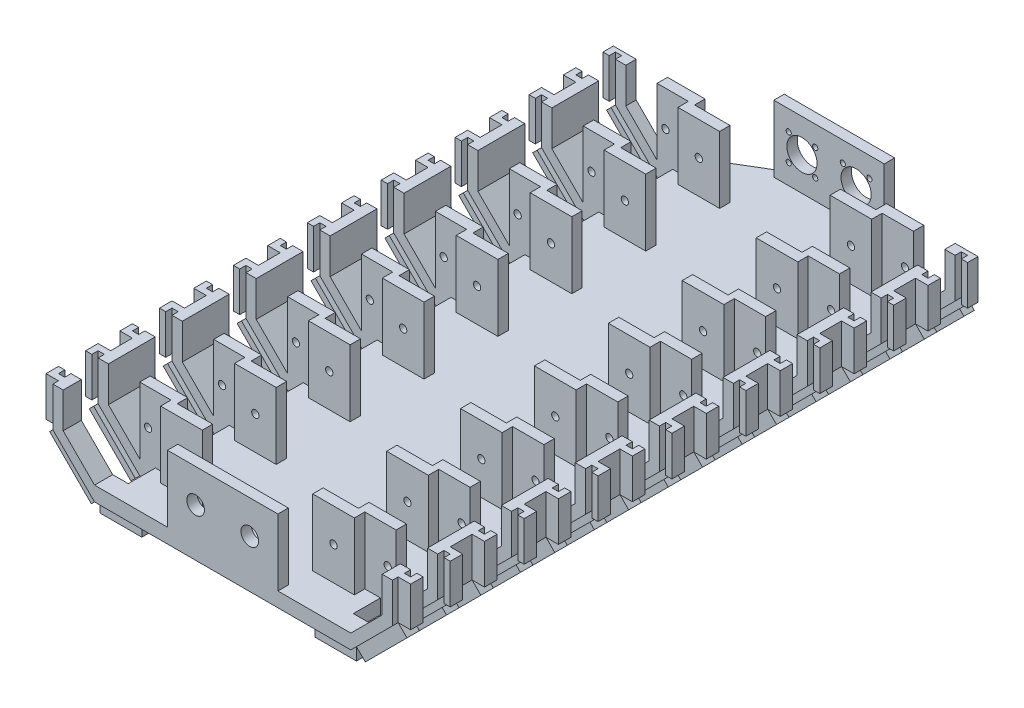
from build123d import *

# Parameters (mm, degrees)
BOSS_EXTRUDE1_DEPTH     = 7
SKETCH2_W               = 123
SKETCH2_H               = 5
BOSS_EXTRUDE2_DEPTH     = 32
SKETCH9_W               = 123
SKETCH9_H               = 7
BOSS_EXTRUDE4_DEPTH     = 5
SKETCH10_W              = 18
SKETCH10_H              = 5
BOSS_EXTRUDE8_DEPTH     = 32
BOSS_EXTRUDE9_DEPTH     = 32
CUT_EXTRUDE4_DEPTH      = 250
CUT_EXTRUDE4_DEPTH_BACK = 32
SKETCH8_R               = 1.75
SKETCH13_W              = 35
SKETCH13_H              = 32
CUT_EXTRUDE5_DEPTH      = 11
BOSS_EXTRUDE10_DEPTH    = 275
CUT_EXTRUDE6_DEPTH      = 166.124952687
CUT_EXTRUDE6_DEPTH_BACK = 166.124952687
SKETCH15_W              = 27.5
SKETCH15_H              = 13
CUT_EXTRUDE7_DEPTH      = 269.925937824
CUT_EXTRUDE7_DEPTH_BACK = 269.925937824
SKETCH16_R              = 1.75
BOSS_EXTRUDE13_DEPTH    = 7
SKETCH18_W              = 53
SKETCH18_H              = 5
BOSS_EXTRUDE14_DEPTH    = 32
SKETCH3_R               = 4.25
CUT_EXTRUDE8_DEPTH      = 334
SKETCH19_R              = 7.25
SKETCH19_R_2            = 1.25
CUT_EXTRUDE9_DEPTH      = 334
SKETCH22_W              = 2
SKETCH22_H              = 28.284271247
SKETCH22_W_2            = 3
BOSS_EXTRUDE15_DEPTH    = 3
SKETCH23_W              = 5
SKETCH23_H              = 28.284271247
SKETCH23_W_2            = 6
BOSS_EXTRUDE16_DEPTH    = 3
SKETCH24_W              = 2
SKETCH24_H              = 19
SKETCH24_W_2            = 3
BOSS_EXTRUDE18_DEPTH    = 3
SKETCH25_W              = 6
SKETCH25_H              = 19
SKETCH25_W_2            = 5
BOSS_EXTRUDE19_DEPTH    = 3
SKETCH27_W              = 20
SKETCH27_H              = 3
SKETCH27_H_2            = 2
BOSS_EXTRUDE25_DEPTH    = 3
SKETCH28_W              = 20
SKETCH28_H              = 6
SKETCH28_H_2            = 5
BOSS_EXTRUDE26_DEPTH    = 3
CUT_EXTRUDE13_DEPTH     = 19


with BuildPart() as part:
    # Sketch1 → Boss-Extrude1 (new body)
    with BuildSketch(Plane(origin=(0, 0, 0), x_dir=(1, 0, 0), z_dir=(0, 1, 0))):
        Polygon((-13, 135), (-36, 135), (-61.5, 135), (-61.5, -135), (-36, -135), (-13, -135), (13, -135), (36, -135), (61.5, -135), (61.5, 135), (36, 135), (13, 135), align=None)
    extrude(amount=BOSS_EXTRUDE1_DEPTH)

    # Sketch2 → Boss-Extrude2 (add)
    with BuildSketch(Plane(origin=(0, 7, 0), x_dir=(1, 0, 0), z_dir=(0, 1, 0))):
        with Locations((0, -132.5)):
            Rectangle(SKETCH2_W, SKETCH2_H)
        Polygon((-36.5, 135), (-26.5, 135), (-26.5, 130), (-46.5, 130), (-46.5, 135), align=None)
        Polygon((46.5, 130), (26.5, 130), (26.5, 135), (36.5, 135), (46.5, 135), align=None)
    extrude(amount=BOSS_EXTRUDE2_DEPTH)

    # Sketch9 → Boss-Extrude4 (add)
    with BuildSketch(Plane(origin=(0, 0, -135), x_dir=(-1, 0, 0), z_dir=(0, 0, -1))):
        with Locations((0, 3.5)):
            Rectangle(SKETCH9_W, SKETCH9_H)
    extrude(amount=BOSS_EXTRUDE4_DEPTH)

    # Sketch10 → Boss-Extrude8 (add)
    with BuildSketch(Plane(origin=(0, 7, 0), x_dir=(1, 0, 0), z_dir=(0, 1, 0))):
        with Locations((-52.5, 137.5)):
            Rectangle(SKETCH10_W, SKETCH10_H)
        with Locations((52.5, 137.5)):
            Rectangle(SKETCH10_W, SKETCH10_H)
    extrude(amount=BOSS_EXTRUDE8_DEPTH)

    # Sketch11 → Boss-Extrude9 (add)
    with BuildSketch(Plane(origin=(0, 7, 0), x_dir=(1, 0, 0), z_dir=(0, 1, 0))):
        Polygon((-46.5, -118.294117647), (-26.5, -118.294117647), (-26.5, -113.294117647), (-43.5, -113.294117647), (-43.5, -108.294117647), (-61.5, -108.294117647), (-61.5, -113.294117647), (-46.5, -113.294117647), align=None)
        Polygon((-61.5, 104.529411765), (-61.5, 99.529411765), (-46.5, 99.529411765), (-46.5, 94.529411765), (-26.5, 94.529411765), (-26.5, 99.529411765), (-43.5, 99.529411765), (-43.5, 104.529411765), align=None)
        Polygon((-61.5, 69.058823529), (-61.5, 64.058823529), (-46.5, 64.058823529), (-46.5, 59.058823529), (-26.5, 59.058823529), (-26.5, 64.058823529), (-43.5, 64.058823529), (-43.5, 69.058823529), align=None)
        Polygon((-61.5, 33.588235294), (-61.5, 28.588235294), (-46.5, 28.588235294), (-46.5, 23.588235294), (-26.5, 23.588235294), (-26.5, 28.588235294), (-43.5, 28.588235294), (-43.5, 33.588235294), align=None)
        Polygon((-61.5, -1.882352941), (-61.5, -6.882352941), (-46.5, -6.882352941), (-46.5, -11.882352941), (-26.5, -11.882352941), (-26.5, -6.882352941), (-43.5, -6.882352941), (-43.5, -1.882352941), align=None)
        Polygon((-61.5, -37.352941176), (-61.5, -42.352941176), (-46.5, -42.352941176), (-46.5, -47.352941176), (-26.5, -47.352941176), (-26.5, -42.352941176), (-43.5, -42.352941176), (-43.5, -37.352941176), align=None)
        Polygon((-61.5, -72.823529412), (-61.5, -77.823529412), (-46.5, -77.823529412), (-46.5, -82.823529412), (-26.5, -82.823529412), (-26.5, -77.823529412), (-43.5, -77.823529412), (-43.5, -72.823529412), align=None)
        Polygon((46.5, 99.529411765), (61.5, 99.529411765), (61.5, 104.529411765), (43.5, 104.529411765), (43.5, 99.529411765), (26.5, 99.529411765), (26.5, 94.529411765), (46.5, 94.529411765), align=None)
        Polygon((46.5, 64.058823529), (61.5, 64.058823529), (61.5, 69.058823529), (43.5, 69.058823529), (43.5, 64.058823529), (26.5, 64.058823529), (26.5, 59.058823529), (46.5, 59.058823529), align=None)
        Polygon((46.5, 28.588235294), (61.5, 28.588235294), (61.5, 33.588235294), (43.5, 33.588235294), (43.5, 28.588235294), (26.5, 28.588235294), (26.5, 23.588235294), (46.5, 23.588235294), align=None)
        Polygon((46.5, -6.882352941), (61.5, -6.882352941), (61.5, -1.882352941), (43.5, -1.882352941), (43.5, -6.882352941), (26.5, -6.882352941), (26.5, -11.882352941), (46.5, -11.882352941), align=None)
        Polygon((46.5, -42.352941176), (61.5, -42.352941176), (61.5, -37.352941176), (43.5, -37.352941176), (43.5, -42.352941176), (26.5, -42.352941176), (26.5, -47.352941176), (46.5, -47.352941176), align=None)
        Polygon((46.5, -77.823529412), (61.5, -77.823529412), (61.5, -72.823529412), (43.5, -72.823529412), (43.5, -77.823529412), (26.5, -77.823529412), (26.5, -82.823529412), (46.5, -82.823529412), align=None)
        Polygon((43.5, -108.294117647), (43.5, -113.294117647), (26.5, -113.294117647), (26.5, -118.294117647), (46.5, -118.294117647), (46.5, -113.294117647), (61.5, -113.294117647), (61.5, -108.294117647), align=None)
    extrude(amount=BOSS_EXTRUDE9_DEPTH)

    # Sketch8 → Cut-Extrude4 (cut, two sides: drawn at the far end of the back side and taken through both)
    with BuildSketch(Plane.XY.offset(-130).offset(-CUT_EXTRUDE4_DEPTH_BACK)):
        with Locations((-36.5, 23)):
            Circle(SKETCH8_R)
        with Locations((36.5, 23)):
            Circle(SKETCH8_R)
    extrude(amount=CUT_EXTRUDE4_DEPTH + CUT_EXTRUDE4_DEPTH_BACK, mode=Mode.SUBTRACT)

    # Sketch13 → Cut-Extrude5 (cut)
    with BuildSketch(Plane.XY.offset(135)):
        with Locations((-44, 23)):
            Rectangle(SKETCH13_W, SKETCH13_H)
        with Locations((44, 23)):
            Rectangle(SKETCH13_W, SKETCH13_H)
    extrude(amount=-CUT_EXTRUDE5_DEPTH, mode=Mode.SUBTRACT)

    # Sketch14 → Boss-Extrude10 (add)
    with BuildSketch(Plane.XY.offset(135)):
        Polygon((-61.5, 0), (-81.5, 20), (-81.5, 39), (-76.55, 39), (-76.55, 22.05), (-61.5, 7), align=None)
        Polygon((76.55, 39), (76.55, 22.05), (61.5, 7), (61.5, 0), (81.5, 20), (81.5, 39), align=None)
    extrude(amount=-BOSS_EXTRUDE10_DEPTH)

    # Sketch15 → Cut-Extrude6 (cut, two sides: drawn at the far end of the back side and taken through both)
    with BuildSketch(Plane(origin=(0, 7, 0), x_dir=(1, 0, 0), z_dir=(0, 1, 0)).offset(-CUT_EXTRUDE6_DEPTH_BACK)):
        with Locations((-67.75, 128.5)):
            Rectangle(SKETCH15_W, SKETCH15_H)
        with Locations((-67.75, 93.029411765)):
            Rectangle(SKETCH15_W, SKETCH15_H)
        with Locations((-67.75, 57.558823529)):
            Rectangle(SKETCH15_W, SKETCH15_H)
        with Locations((-67.75, 22.088235294)):
            Rectangle(SKETCH15_W, SKETCH15_H)
        with Locations((-67.75, -13.382352941)):
            Rectangle(SKETCH15_W, SKETCH15_H)
        with Locations((-67.75, -48.852941176)):
            Rectangle(SKETCH15_W, SKETCH15_H)
        with Locations((-67.75, -84.323529412)):
            Rectangle(SKETCH15_W, SKETCH15_H)
        with Locations((-67.75, -119.794117647)):
            Rectangle(SKETCH15_W, SKETCH15_H)
        with Locations((67.75, -119.794117647)):
            Rectangle(SKETCH15_W, SKETCH15_H)
        with Locations((67.75, -84.323529412)):
            Rectangle(SKETCH15_W, SKETCH15_H)
        with Locations((67.75, -48.852941176)):
            Rectangle(SKETCH15_W, SKETCH15_H)
        with Locations((67.75, -13.382352941)):
            Rectangle(SKETCH15_W, SKETCH15_H)
        with Locations((67.75, 22.088235294)):
            Rectangle(SKETCH15_W, SKETCH15_H)
        with Locations((67.75, 57.558823529)):
            Rectangle(SKETCH15_W, SKETCH15_H)
        with Locations((67.75, 93.029411765)):
            Rectangle(SKETCH15_W, SKETCH15_H)
        with Locations((67.75, 128.5)):
            Rectangle(SKETCH15_W, SKETCH15_H)
    extrude(amount=CUT_EXTRUDE6_DEPTH + CUT_EXTRUDE6_DEPTH_BACK, mode=Mode.SUBTRACT)

    # Sketch16 → Cut-Extrude7 (cut, two sides: drawn at the far end of the back side and taken through both)
    with BuildSketch(Plane.XY.offset(113.294117647).offset(-CUT_EXTRUDE7_DEPTH_BACK)):
        with Locations((-57.5, 22)):
            Circle(SKETCH16_R)
        with Locations((57.5, 22)):
            Circle(SKETCH16_R)
    extrude(amount=CUT_EXTRUDE7_DEPTH + CUT_EXTRUDE7_DEPTH_BACK, mode=Mode.SUBTRACT)

    # Sketch17 → Boss-Extrude13 (add)
    with BuildSketch(Plane(origin=(0, 7, 0), x_dir=(1, 0, 0), z_dir=(0, 1, 0))):
        Polygon((-61.5, 140), (-26.5, 226), (0, 226), (26.5, 226), (61.5, 140), align=None)
    extrude(amount=-BOSS_EXTRUDE13_DEPTH)

    # Sketch18 → Boss-Extrude14 (add)
    with BuildSketch(Plane(origin=(0, 7, 0), x_dir=(1, 0, 0), z_dir=(0, 1, 0))):
        with Locations((0, 158.5)):
            Rectangle(SKETCH18_W, SKETCH18_H)
    extrude(amount=BOSS_EXTRUDE14_DEPTH)

    # Sketch3 → Cut-Extrude8 (cut)
    with BuildSketch(Plane.XY.offset(135)):
        with Locations((-13, 23)):
            Circle(SKETCH3_R)
        with Locations((13, 23)):
            Circle(SKETCH3_R)
    extrude(amount=-CUT_EXTRUDE8_DEPTH, mode=Mode.SUBTRACT)

    # Sketch19 → Cut-Extrude9 (cut)
    with BuildSketch(Plane.XY.offset(-156)):
        with Locations((-13, 23)):
            Circle(SKETCH19_R)
        with Locations((-6.636038969, 16.636038969)):
            Circle(SKETCH19_R_2)
        with Locations((-6.636038969, 29.363961031)):
            Circle(SKETCH19_R_2)
        with Locations((-19.363961031, 29.363961031)):
            Circle(SKETCH19_R_2)
        with Locations((-19.363961031, 16.636038969)):
            Circle(SKETCH19_R_2)
        with Locations((13, 23)):
            Circle(SKETCH19_R)
        with Locations((19.363961031, 16.636038969)):
            Circle(SKETCH19_R_2)
        with Locations((6.636038969, 16.636038969)):
            Circle(SKETCH19_R_2)
        with Locations((6.636038969, 29.363961031)):
            Circle(SKETCH19_R_2)
        with Locations((19.363961031, 29.363961031)):
            Circle(SKETCH19_R_2)
    extrude(amount=-CUT_EXTRUDE9_DEPTH, mode=Mode.SUBTRACT)

    # Sketch22 → Boss-Extrude15 (add)
    with BuildSketch(Plane(origin=(-30.75, -30.75, 0), x_dir=(0, 0, 1), z_dir=(-0.7071067811865465, -0.7071067811865486, 0))):
        with Locations((-139, 57.629202667)):
            Rectangle(SKETCH22_W, SKETCH22_H)
        with Locations((-117.5, 57.629202667)):
            Rectangle(SKETCH22_W_2, SKETCH22_H)
        with Locations((-104.029411765, 57.629202667)):
            Rectangle(SKETCH22_W_2, SKETCH22_H)
        with Locations((-82.029411765, 57.629202667)):
            Rectangle(SKETCH22_W_2, SKETCH22_H)
        with Locations((-68.558823529, 57.629202667)):
            Rectangle(SKETCH22_W_2, SKETCH22_H)
        with Locations((-46.558823529, 57.629202667)):
            Rectangle(SKETCH22_W_2, SKETCH22_H)
        with Locations((-33.088235294, 57.629202667)):
            Rectangle(SKETCH22_W_2, SKETCH22_H)
        with Locations((-11.088235294, 57.629202667)):
            Rectangle(SKETCH22_W_2, SKETCH22_H)
        with Locations((2.382352941, 57.629202667)):
            Rectangle(SKETCH22_W_2, SKETCH22_H)
        with Locations((24.382352941, 57.629202667)):
            Rectangle(SKETCH22_W_2, SKETCH22_H)
        with Locations((37.852941176, 57.629202667)):
            Rectangle(SKETCH22_W_2, SKETCH22_H)
        with Locations((59.852941176, 57.629202667)):
            Rectangle(SKETCH22_W_2, SKETCH22_H)
        with Locations((73.323529412, 57.629202667)):
            Rectangle(SKETCH22_W_2, SKETCH22_H)
        with Locations((95.323529412, 57.629202667)):
            Rectangle(SKETCH22_W_2, SKETCH22_H)
        with Locations((108.794117647, 57.629202667)):
            Rectangle(SKETCH22_W_2, SKETCH22_H)
        with Locations((130.794117647, 57.629202667)):
            Rectangle(SKETCH22_W_2, SKETCH22_H)
    boss_extrude15 = extrude(amount=BOSS_EXTRUDE15_DEPTH)

    # Sketch23 → Boss-Extrude16 (add)
    with BuildSketch(Plane(origin=(-32.871320344, -32.871320344, 0), x_dir=(0, 0, 1), z_dir=(-0.7071067811865465, -0.7071067811865487, 0))):
        with Locations((-137.5, 57.629202667)):
            Rectangle(SKETCH23_W, SKETCH23_H)
        with Locations((-119, 57.629202667)):
            Rectangle(SKETCH23_W_2, SKETCH23_H)
        with Locations((-102.529411765, 57.629202667)):
            Rectangle(SKETCH23_W_2, SKETCH23_H)
        with Locations((-83.529411765, 57.629202667)):
            Rectangle(SKETCH23_W_2, SKETCH23_H)
        with Locations((-67.058823529, 57.629202667)):
            Rectangle(SKETCH23_W_2, SKETCH23_H)
        with Locations((-48.058823529, 57.629202667)):
            Rectangle(SKETCH23_W_2, SKETCH23_H)
        with Locations((-31.588235294, 57.629202667)):
            Rectangle(SKETCH23_W_2, SKETCH23_H)
        with Locations((-12.588235294, 57.629202667)):
            Rectangle(SKETCH23_W_2, SKETCH23_H)
        with Locations((3.882352941, 57.629202667)):
            Rectangle(SKETCH23_W_2, SKETCH23_H)
        with Locations((22.882352941, 57.629202667)):
            Rectangle(SKETCH23_W_2, SKETCH23_H)
        with Locations((39.352941176, 57.629202667)):
            Rectangle(SKETCH23_W_2, SKETCH23_H)
        with Locations((58.352941176, 57.629202667)):
            Rectangle(SKETCH23_W_2, SKETCH23_H)
        with Locations((74.823529412, 57.629202667)):
            Rectangle(SKETCH23_W_2, SKETCH23_H)
        with Locations((93.823529412, 57.629202667)):
            Rectangle(SKETCH23_W_2, SKETCH23_H)
        with Locations((110.294117647, 57.629202667)):
            Rectangle(SKETCH23_W_2, SKETCH23_H)
        with Locations((129.294117647, 57.629202667)):
            Rectangle(SKETCH23_W_2, SKETCH23_H)
    boss_extrude16 = extrude(amount=BOSS_EXTRUDE16_DEPTH)

    # Sketch24 → Boss-Extrude18 (add)
    with BuildSketch(Plane.ZY.offset(81.5)):
        with Locations((-139, 29.5)):
            Rectangle(SKETCH24_W, SKETCH24_H)
        with Locations((-117.5, 29.5)):
            Rectangle(SKETCH24_W_2, SKETCH24_H)
        with Locations((-104.029411765, 29.5)):
            Rectangle(SKETCH24_W_2, SKETCH24_H)
        with Locations((-82.029411765, 29.5)):
            Rectangle(SKETCH24_W_2, SKETCH24_H)
        with Locations((-68.558823529, 29.5)):
            Rectangle(SKETCH24_W_2, SKETCH24_H)
        with Locations((-46.558823529, 29.5)):
            Rectangle(SKETCH24_W_2, SKETCH24_H)
        with Locations((-33.088235294, 29.5)):
            Rectangle(SKETCH24_W_2, SKETCH24_H)
        with Locations((-11.088235294, 29.5)):
            Rectangle(SKETCH24_W_2, SKETCH24_H)
        with Locations((2.382352941, 29.5)):
            Rectangle(SKETCH24_W_2, SKETCH24_H)
        with Locations((24.382352941, 29.5)):
            Rectangle(SKETCH24_W_2, SKETCH24_H)
        with Locations((37.852941176, 29.5)):
            Rectangle(SKETCH24_W_2, SKETCH24_H)
        with Locations((59.852941176, 29.5)):
            Rectangle(SKETCH24_W_2, SKETCH24_H)
        with Locations((73.323529412, 29.5)):
            Rectangle(SKETCH24_W_2, SKETCH24_H)
        with Locations((95.323529412, 29.5)):
            Rectangle(SKETCH24_W_2, SKETCH24_H)
        with Locations((108.794117647, 29.5)):
            Rectangle(SKETCH24_W_2, SKETCH24_H)
        with Locations((130.794117647, 29.5)):
            Rectangle(SKETCH24_W_2, SKETCH24_H)
    boss_extrude18 = extrude(amount=BOSS_EXTRUDE18_DEPTH)

    # Sketch25 → Boss-Extrude19 (add)
    with BuildSketch(Plane.ZY.offset(84.5)):
        with Locations((-67.058823529, 29.5)):
            Rectangle(SKETCH25_W, SKETCH25_H)
        with Locations((-137.5, 29.5)):
            Rectangle(SKETCH25_W_2, SKETCH25_H)
        with Locations((-119, 29.5)):
            Rectangle(SKETCH25_W, SKETCH25_H)
        with Locations((-102.529411765, 29.5)):
            Rectangle(SKETCH25_W, SKETCH25_H)
        with Locations((-83.529411765, 29.5)):
            Rectangle(SKETCH25_W, SKETCH25_H)
        with Locations((-48.058823529, 29.5)):
            Rectangle(SKETCH25_W, SKETCH25_H)
        with Locations((-31.588235294, 29.5)):
            Rectangle(SKETCH25_W, SKETCH25_H)
        with Locations((-12.588235294, 29.5)):
            Rectangle(SKETCH25_W, SKETCH25_H)
        with Locations((3.882352941, 29.5)):
            Rectangle(SKETCH25_W, SKETCH25_H)
        with Locations((22.882352941, 29.5)):
            Rectangle(SKETCH25_W, SKETCH25_H)
        with Locations((39.352941176, 29.5)):
            Rectangle(SKETCH25_W, SKETCH25_H)
        with Locations((58.352941176, 29.5)):
            Rectangle(SKETCH25_W, SKETCH25_H)
        with Locations((74.823529412, 29.5)):
            Rectangle(SKETCH25_W, SKETCH25_H)
        with Locations((93.823529412, 29.5)):
            Rectangle(SKETCH25_W, SKETCH25_H)
        with Locations((110.294117647, 29.5)):
            Rectangle(SKETCH25_W, SKETCH25_H)
        with Locations((129.294117647, 29.5)):
            Rectangle(SKETCH25_W, SKETCH25_H)
    boss_extrude19 = extrude(amount=BOSS_EXTRUDE19_DEPTH)

    # Mirror1: Boss-Extrude18 across plane
    add(boss_extrude18.mirror(Plane(origin=(0, 0, 0), x_dir=(0, 0, 1), z_dir=(1, 0, 0))))

    # Mirror2: Boss-Extrude19 across plane
    add(boss_extrude19.mirror(Plane(origin=(0, 0, 0), x_dir=(0, 0, 1), z_dir=(1, 0, 0))))

    # Mirror3: Boss-Extrude15 across plane
    add(boss_extrude15.mirror(Plane(origin=(0, 0, 0), x_dir=(0, 0, 1), z_dir=(1, 0, 0))))

    # Mirror4: Boss-Extrude16 across plane
    add(boss_extrude16.mirror(Plane(origin=(0, 0, 0), x_dir=(0, 0, 1), z_dir=(1, 0, 0))))

    # Sketch27 → Boss-Extrude25 (add)
    with BuildSketch(Plane.XZ):
        with Locations((-51.5, 130.794117647)):
            Rectangle(SKETCH27_W, SKETCH27_H)
        with Locations((-51.5, 108.794117647)):
            Rectangle(SKETCH27_W, SKETCH27_H)
        with Locations((-51.5, 95.323529412)):
            Rectangle(SKETCH27_W, SKETCH27_H)
        with Locations((-51.5, 73.323529412)):
            Rectangle(SKETCH27_W, SKETCH27_H)
        with Locations((-51.5, 59.852941176)):
            Rectangle(SKETCH27_W, SKETCH27_H)
        with Locations((-51.5, 37.852941176)):
            Rectangle(SKETCH27_W, SKETCH27_H)
        with Locations((-51.5, 24.382352941)):
            Rectangle(SKETCH27_W, SKETCH27_H)
        with Locations((-51.5, 2.382352941)):
            Rectangle(SKETCH27_W, SKETCH27_H)
        with Locations((-51.5, -11.088235294)):
            Rectangle(SKETCH27_W, SKETCH27_H)
        with Locations((-51.5, -33.088235294)):
            Rectangle(SKETCH27_W, SKETCH27_H)
        with Locations((-51.5, -46.558823529)):
            Rectangle(SKETCH27_W, SKETCH27_H)
        with Locations((-51.5, -68.558823529)):
            Rectangle(SKETCH27_W, SKETCH27_H)
        with Locations((-51.5, -82.029411765)):
            Rectangle(SKETCH27_W, SKETCH27_H)
        with Locations((-51.5, -104.029411765)):
            Rectangle(SKETCH27_W, SKETCH27_H)
        with Locations((-51.5, -117.5)):
            Rectangle(SKETCH27_W, SKETCH27_H)
        with Locations((-51.5, -139)):
            Rectangle(SKETCH27_W, SKETCH27_H_2)
        with Locations((51.5, -139)):
            Rectangle(SKETCH27_W, SKETCH27_H_2)
        with Locations((51.5, -117.5)):
            Rectangle(SKETCH27_W, SKETCH27_H)
        with Locations((51.5, -104.029411765)):
            Rectangle(SKETCH27_W, SKETCH27_H)
        with Locations((51.5, -82.029411765)):
            Rectangle(SKETCH27_W, SKETCH27_H)
        with Locations((51.5, -68.558823529)):
            Rectangle(SKETCH27_W, SKETCH27_H)
        with Locations((51.5, -46.558823529)):
            Rectangle(SKETCH27_W, SKETCH27_H)
        with Locations((51.5, -33.088235294)):
            Rectangle(SKETCH27_W, SKETCH27_H)
        with Locations((51.5, -11.088235294)):
            Rectangle(SKETCH27_W, SKETCH27_H)
        with Locations((51.5, 2.382352941)):
            Rectangle(SKETCH27_W, SKETCH27_H)
        with Locations((51.5, 24.382352941)):
            Rectangle(SKETCH27_W, SKETCH27_H)
        with Locations((51.5, 37.852941176)):
            Rectangle(SKETCH27_W, SKETCH27_H)
        with Locations((51.5, 59.852941176)):
            Rectangle(SKETCH27_W, SKETCH27_H)
        with Locations((51.5, 73.323529412)):
            Rectangle(SKETCH27_W, SKETCH27_H)
        with Locations((51.5, 95.323529412)):
            Rectangle(SKETCH27_W, SKETCH27_H)
        with Locations((51.5, 108.794117647)):
            Rectangle(SKETCH27_W, SKETCH27_H)
        with Locations((51.5, 130.794117647)):
            Rectangle(SKETCH27_W, SKETCH27_H)
    extrude(amount=BOSS_EXTRUDE25_DEPTH)

    # Sketch28 → Boss-Extrude26 (add)
    with BuildSketch(Plane.XZ.offset(3)):
        with Locations((51.5, -48.058823529)):
            Rectangle(SKETCH28_W, SKETCH28_H)
        with Locations((51.5, -137.5)):
            Rectangle(SKETCH28_W, SKETCH28_H_2)
        with Locations((51.5, -119)):
            Rectangle(SKETCH28_W, SKETCH28_H)
        with Locations((51.5, -102.529411765)):
            Rectangle(SKETCH28_W, SKETCH28_H)
        with Locations((51.5, -83.529411765)):
            Rectangle(SKETCH28_W, SKETCH28_H)
        with Locations((51.5, -67.058823529)):
            Rectangle(SKETCH28_W, SKETCH28_H)
        with Locations((51.5, -12.588235294)):
            Rectangle(SKETCH28_W, SKETCH28_H)
        with Locations((51.5, -31.588235294)):
            Rectangle(SKETCH28_W, SKETCH28_H)
        with Locations((51.5, 22.882352941)):
            Rectangle(SKETCH28_W, SKETCH28_H)
        with Locations((51.5, 3.882352941)):
            Rectangle(SKETCH28_W, SKETCH28_H)
        with Locations((51.5, 58.352941176)):
            Rectangle(SKETCH28_W, SKETCH28_H)
        with Locations((51.5, 39.352941176)):
            Rectangle(SKETCH28_W, SKETCH28_H)
        with Locations((51.5, 93.823529412)):
            Rectangle(SKETCH28_W, SKETCH28_H)
        with Locations((51.5, 74.823529412)):
            Rectangle(SKETCH28_W, SKETCH28_H)
        with Locations((51.5, 129.294117647)):
            Rectangle(SKETCH28_W, SKETCH28_H)
        with Locations((51.5, 110.294117647)):
            Rectangle(SKETCH28_W, SKETCH28_H)
        with Locations((-51.5, 110.294117647)):
            Rectangle(SKETCH28_W, SKETCH28_H)
        with Locations((-51.5, 129.294117647)):
            Rectangle(SKETCH28_W, SKETCH28_H)
        with Locations((-51.5, 74.823529412)):
            Rectangle(SKETCH28_W, SKETCH28_H)
        with Locations((-51.5, 93.823529412)):
            Rectangle(SKETCH28_W, SKETCH28_H)
        with Locations((-51.5, 39.352941176)):
            Rectangle(SKETCH28_W, SKETCH28_H)
        with Locations((-51.5, 58.352941176)):
            Rectangle(SKETCH28_W, SKETCH28_H)
        with Locations((-51.5, 3.882352941)):
            Rectangle(SKETCH28_W, SKETCH28_H)
        with Locations((-51.5, 22.882352941)):
            Rectangle(SKETCH28_W, SKETCH28_H)
        with Locations((-51.5, -31.588235294)):
            Rectangle(SKETCH28_W, SKETCH28_H)
        with Locations((-51.5, -12.588235294)):
            Rectangle(SKETCH28_W, SKETCH28_H)
        with Locations((-51.5, -67.058823529)):
            Rectangle(SKETCH28_W, SKETCH28_H)
        with Locations((-51.5, -48.058823529)):
            Rectangle(SKETCH28_W, SKETCH28_H)
        with Locations((-51.5, -83.529411765)):
            Rectangle(SKETCH28_W, SKETCH28_H)
        with Locations((-51.5, -102.529411765)):
            Rectangle(SKETCH28_W, SKETCH28_H)
        with Locations((-51.5, -119)):
            Rectangle(SKETCH28_W, SKETCH28_H)
        with Locations((-51.5, -137.5)):
            Rectangle(SKETCH28_W, SKETCH28_H_2)
    extrude(amount=BOSS_EXTRUDE26_DEPTH)

    # Sketch29 → Cut-Extrude13 (cut)
    with BuildSketch(Plane(origin=(0, 7, 0), x_dir=(1, 0, 0), z_dir=(0, 1, 0))):
        Polygon((-61.5, 140), (-26.5, 161), (26.5, 161), (61.5, 140), (26.5, 226), (-26.5, 226), align=None)
    extrude(amount=-CUT_EXTRUDE13_DEPTH, mode=Mode.SUBTRACT)


solid = part.part
